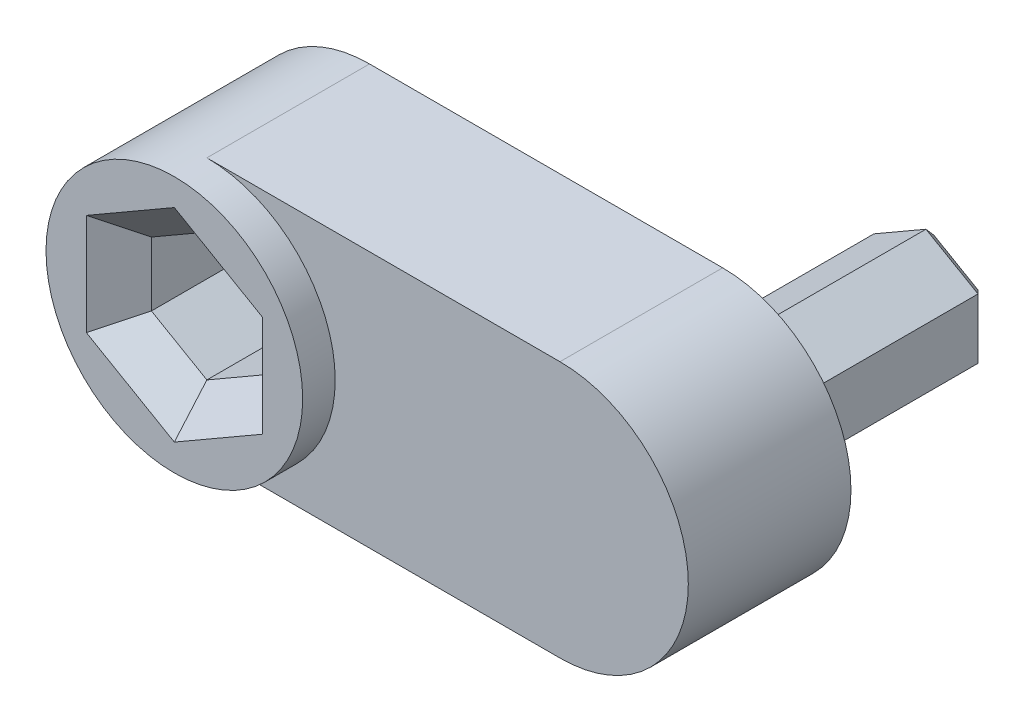
from build123d import *

# Parameters (mm, degrees)
BOSS_EXTRU_1_DEPTH      = 10
BOSS_EXTRU_3_DEPTH      = 13
ENL_V_MAT_EXTRU_1_DEPTH = 31.702233225
BOSS_EXTRU_4_DEPTH      = 2
CHANFREIN1_SIZE         = 2
CHANFREIN2_SIZE         = 0.5


with BuildPart() as part:
    # Esquisse1 → Boss.-Extru.1 (new body)
    with BuildSketch(Plane(origin=(0, 0, 0), x_dir=(0, 1, 0), z_dir=(0, 0, 1))):
        with BuildLine():
            Line((-7.89, -10.855), (-7.89, 10.855))
            ThreePointArc((-7.89, 10.855), (0, 18.745), (7.89, 10.855))
            Line((7.89, 10.855), (7.89, -10.855))
            ThreePointArc((7.89, -10.855), (0, -18.745), (-7.89, -10.855))
        make_face()
    extrude(amount=BOSS_EXTRU_1_DEPTH)

    # Esquisse3 → Boss.-Extru.3 (add)
    with BuildSketch(Plane(origin=(0, 0, 0), x_dir=(1, 0, 0), z_dir=(0, 0, -1))):
        Polygon((10.855, -3.695041723), (14.055, -1.847520861), (14.055, 1.847520861), (10.855, 3.695041723), (7.655, 1.847520861), (7.655, -1.847520861), align=None)
    extrude(amount=BOSS_EXTRU_3_DEPTH)

    # Esquisse2 → Enlèv. mat.-Extru.1 (cut, through all)
    with BuildSketch(Plane.XY.offset(10)):
        Polygon((-10.855, 3.935), (-14.262809964, 1.9675), (-14.262809964, -1.9675), (-10.855, -3.935), (-7.447190036, -1.9675), (-7.447190036, 1.9675), align=None)
    extrude(amount=-ENL_V_MAT_EXTRU_1_DEPTH, mode=Mode.SUBTRACT)

    # Esquisse4 → Boss.-Extru.4 (add)
    with BuildSketch(Plane.XY.offset(10)):
        with BuildLine():
            ThreePointArc((-10.855, -7.89), (-5.275927496, -5.579072504), (-2.965, 0))
            ThreePointArc((-2.965, 0), (-5.275927496, 5.579072504), (-10.855, 7.89))
            ThreePointArc((-10.855, 7.89), (-18.745, 0), (-10.855, -7.89))
        make_face()
        Polygon((-10.855, 3.935), (-7.447190036, 1.9675), (-7.447190036, -1.9675), (-10.855, -3.935), (-14.262809964, -1.9675), (-14.262809964, 1.9675), align=None, mode=Mode.SUBTRACT)
    extrude(amount=BOSS_EXTRU_4_DEPTH)

    # Chanfrein1
    chanfrein1_edges = [part.edges().sort_by_distance(p)[0] for p in [
        (-9.151095018, 2.95125, 12),
        (-7.447190036, 0, 12),
        (-9.151095018, -2.95125, 12),
        (-12.558904982, -2.95125, 12),
        (-14.262809964, 0, 12),
        (-12.558904982, 2.95125, 12),
    ]]
    chamfer(chanfrein1_edges, length=CHANFREIN1_SIZE - 0.0001)  # a hair under: the kernel refuses the full size

    # Chanfrein2
    chanfrein2_edges = [part.edges().sort_by_distance(p)[0] for p in [
        (9.255, 2.771281292, -13),
        (12.455, 2.771281292, -13),
        (14.055, 0, -13),
        (12.455, -2.771281292, -13),
        (9.255, -2.771281292, -13),
        (7.655, 0, -13),
    ]]
    chamfer(chanfrein2_edges, length=CHANFREIN2_SIZE)


solid = part.part
